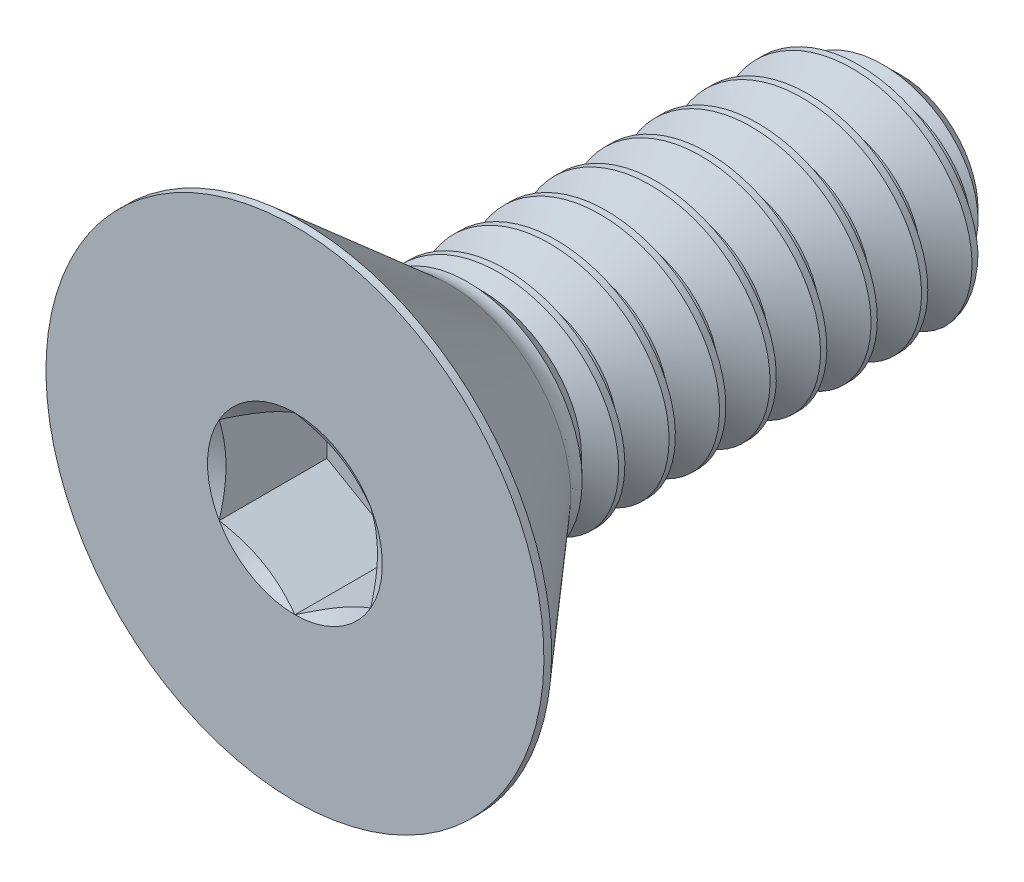
from build123d import *

# Parameters (mm, degrees)
SKETCH1_W          = 12.7
SKETCH1_H          = 2.413
CHAMFER1_SIZE      = 0.79375
CUT_SWEEP1_PITCH   = 1.058333333
CUT_EXTRUDE2_DEPTH = 2.25806


with BuildPart() as part:
    # Sketch1 → Revolve1 (revolve)
    with BuildSketch(Plane(origin=(0, 0, 0), x_dir=(0, 0, -1), z_dir=(1, 0, 0))):
        with Locations((6.35, 1.2065)):
            Rectangle(SKETCH1_W, SKETCH1_H)
    revolve(axis=Axis((0, 0, -12.7), (0, 0, 1)))

    # Chamfer1
    chamfer1_edges = [part.edges().sort_by_distance(p)[0] for p in [
        (0, -2.413, -12.7),
    ]]
    chamfer(chamfer1_edges, length=CHAMFER1_SIZE)

    # Cut-Sweep1: arcs per turn and ends read off the stored shape
    # Cut-Sweep1: the profile of Sketch2 profile screwed along a right-hand helix through 13 turns, 8 arcs to a turn; built about Z, then put on its axis
    cut_sweep1_z = Axis((0, 0, 0), (0, 0, 1))
    cut_sweep1_corners = [(2.4133, 0, 0.000173205), (2.4133, 0, -0.926214872), (1.725592336, 0, -0.529166667), (1.725592336, 0, -0.396875)]
    with BuildLine(mode=Mode.PRIVATE) as cut_sweep1_profile:
        Line(cut_sweep1_corners[0], cut_sweep1_corners[1])
        Line(cut_sweep1_corners[1], cut_sweep1_corners[2])
        Line(cut_sweep1_corners[2], cut_sweep1_corners[3])
        Line(cut_sweep1_corners[3], cut_sweep1_corners[0])
    cut_sweep1_cap = Face(cut_sweep1_profile.wire())
    cut_sweep1_turn_angles = [0, 22.5, 45, 67.5, 90, 112.5, 135, 157.5, 180, 202.5, 225, 247.5, 270, 292.5, 315, 337.5, 360]
    cut_sweep1_turn_weights = [1, 0.9238795325112867, 1, 0.9238795325112867, 1, 0.9238795325112867, 1, 0.9238795325112867, 1, 0.9238795325112867, 1, 0.9238795325112867, 1, 0.9238795325112867, 1, 0.9238795325112867, 1]
    cut_sweep1_turn_rails = [Edge.make_bspline([Vector(p[0], p[1], 0).rotate(cut_sweep1_z, cut_sweep1_turn_angles[k]) / cut_sweep1_turn_weights[k] + Vector(0, 0, p[2] + CUT_SWEEP1_PITCH * cut_sweep1_turn_angles[k] / 360) for k in range(17)], [0, 0, 0, 1, 1, 2, 2, 3, 3, 4, 4, 5, 5, 6, 6, 7, 7, 8, 8, 8], 2, cut_sweep1_turn_weights) for p in cut_sweep1_corners]
    cut_sweep1_turn_sides = [Face.make_surface_from_curves(cut_sweep1_turn_rails[p[0]], cut_sweep1_turn_rails[p[1]]) for p in [(0, 1), (1, 2), (2, 3), (3, 0)]]
    cut_sweep1 = Plane(origin=(0, 0, -12.7), x_dir=(0, 1, 0), z_dir=(0, 0, 1)) * Solid(Shell([*[p.moved(Location((0, 0, CUT_SWEEP1_PITCH * i))) for i in range(13) for p in cut_sweep1_turn_sides], cut_sweep1_cap, cut_sweep1_cap.rotate(cut_sweep1_z, 4680).moved(Location((0, 0, CUT_SWEEP1_PITCH * 4680 / 360)))]))
    add(cut_sweep1, mode=Mode.SUBTRACT)

    # Sketch7 → Revolve2 (revolve)
    with BuildSketch(Plane(origin=(0, 0, 0), x_dir=(0, 0, -1), z_dir=(1, 0, 0)), mode=Mode.PRIVATE) as revolve2_sk:
        with BuildLine():
            Line((0, 5.2197), (0.16129, 5.2197))
            Line((0.16129, 5.2197), (3.2258, 2.555762099))
            ThreePointArc((3.2258, 2.555762099), (3.403809493, 2.44985758), (3.607634579, 2.413))
            Line((3.607634579, 2.413), (3.607634579, 0))
            Line((3.607634579, 0), (0, 0))
            Line((0, 0), (0, 5.2197))
        make_face()
    revolve(revolve2_sk.sketch.rotate(Axis((0, 0, 0), (0, 0, -1)), 189.052465709), axis=Axis((0, 0, 0), (0, 0, -1)))

    # Boss-Extrude1 cone 1 section (through the dimple's axis) → Boss-Extrude1 (revolve)
    with BuildSketch(Plane(origin=(0, 0, -3.607634579), x_dir=(0, -1, 0), z_dir=(1, 0, 0))):
        Polygon((0, 0), (2.413, 0), (0, 2.330207014), align=None)
    revolve(axis=Axis((0, 0, -3.607634579), (0, 0, -1)))

    # Sketch5 → Cut-Extrude2 (cut)
    with BuildSketch(Plane.XY):
        Polygon((0, 1.833087105), (-1.5875, 0.916543552), (-1.5875, -0.916543552), (0, -1.833087105), (1.5875, -0.916543552), (1.5875, 0.916543552), align=None)
    extrude(amount=-CUT_EXTRUDE2_DEPTH, mode=Mode.SUBTRACT)

    # Cut-Extrude3 cone 1 section (through the dimple's axis) → Cut-Extrude3 (revolve, cut)
    with BuildSketch(Plane(origin=(0, 0, 0), x_dir=(0, -1, 0), z_dir=(1, 0, 0))):
        Polygon((0, 0), (1.833087105, 0), (0, 1.058333333), align=None)
    revolve(axis=Axis((0, 0, 0), (0, 0, -1)), mode=Mode.SUBTRACT)


solid = part.part
